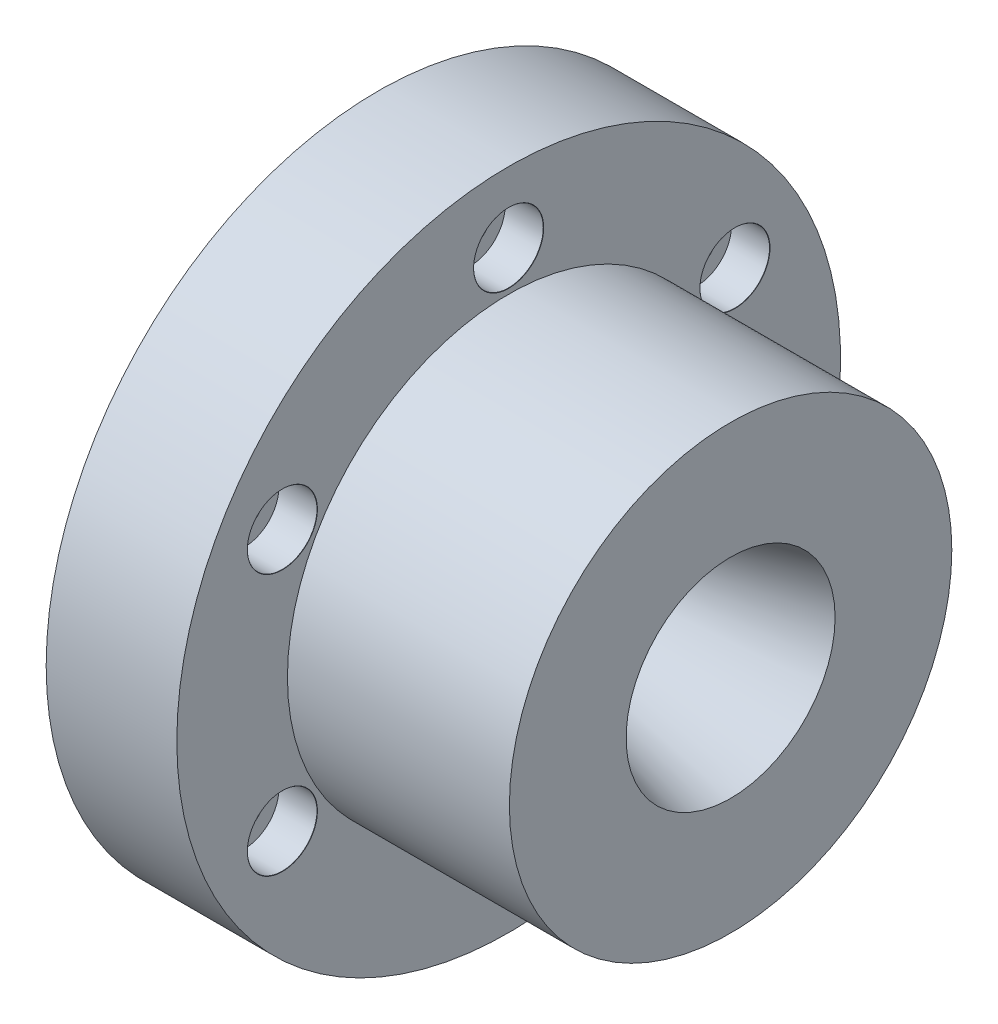
from build123d import *

# Parameters (mm, degrees)
SKETCH2_R           = 38.1
SKETCH2_R_2         = 25.4
BOSS_EXTRUDE1_DEPTH = 15
CIRPATTERN1_COUNT   = 6


with BuildPart() as part:
    # Sketch1 → Revolve1 (revolve)
    with BuildSketch(Plane.XY):
        with BuildLine():
            Line((-20.168474935, 17.5), (-2.622580251, 7.369872981))
            ThreePointArc((-2.622580251, 7.369872981), (-0.775211212, 6.742775693), (1.171514975, 6.870370869))
            Line((1.171514975, 6.870370869), (20.315551517, 12))
            Line((20.315551517, 12), (20.315551517, 25.4))
            Line((20.315551517, 25.4), (-20.168474935, 25.4))
            Line((-20.168474935, 25.4), (-20.168474935, 17.5))
        make_face()
    revolve(axis=Axis((0, 0, 0), (-1, 0, 0)))

    # Sketch2 → Boss-Extrude1 (add)
    with BuildSketch(Plane.ZY.offset(20.168474935)):
        Circle(SKETCH2_R)
        Circle(SKETCH2_R_2, mode=Mode.SUBTRACT)
    extrude(amount=-BOSS_EXTRUDE1_DEPTH)

    # Sketch6 → CBORE for M4 Hex Socket Head Cap Screw1 (revolve, cut)
    with BuildSketch(Plane(origin=(-5.168474935, 30, 0), x_dir=(0, 0, -1), z_dir=(0, 1, 0))):
        Polygon((0, 0), (0, 15), (2.25, 15), (2.25, 4.4), (4, 4.4), (4, 0.025), (4.025, 0), align=None)
    cbore_for_m4_hex_socket_head_cap_screw1 = revolve(axis=Axis((1.181525065, 30, 0), (-1, 0, 0)), mode=Mode.SUBTRACT)

    # CirPattern1: CBORE for M4 Hex Socket Head Cap Screw1 ×6 about axis
    cirpattern1_axis = Axis((-5.168474935, 0, 0), (-1, 0, 0))
    for i in range(1, CIRPATTERN1_COUNT):
        add(cbore_for_m4_hex_socket_head_cap_screw1.rotate(cirpattern1_axis, i * 360 / CIRPATTERN1_COUNT), mode=Mode.SUBTRACT)


solid = part.part
